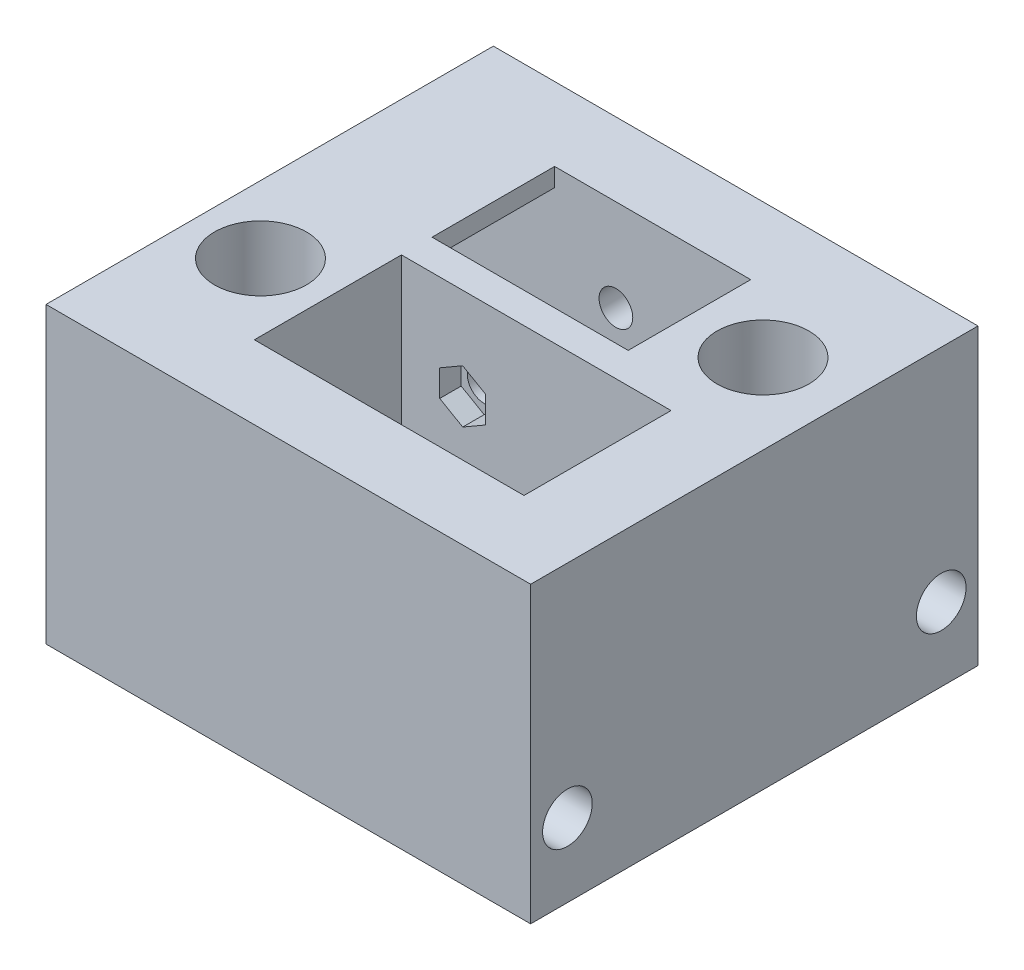
from build123d import *

# Parameters (mm, degrees)
SKETCH1_R           = 7.5
SKETCH1_W           = 44
SKETCH1_H           = 24
BOSS_EXTRUDE1_DEPTH = 48
SKETCH3_R           = 4.05
CUT_EXTRUDE1_DEPTH  = 82
SKETCH4_R           = 2.75
CUT_EXTRUDE2_DEPTH  = 82
SKETCH6_W           = 22
SKETCH6_H           = 20
BOSS_EXTRUDE3_DEPTH = 3
SKETCH7_W           = 22
SKETCH7_H           = 20
BOSS_EXTRUDE4_DEPTH = 21
CUT_EXTRUDE4_DEPTH  = 3.5


with BuildPart() as part:
    # Sketch1 → Boss-Extrude1 (new body)
    with BuildSketch(Plane(origin=(0, 0, 0), x_dir=(1, 0, 0), z_dir=(0, 1, 0))):
        Polygon((44, -12), (-22, -12), (-22, 29), (32, 29), (32, 49), (-22, 49), (-22, 61), (44, 61), (57.086114139, 61), (57.086114139, -12), align=None)
        with Locations((-11, 12)):
            Circle(SKETCH1_R, mode=Mode.SUBTRACT)
        with Locations((22, 12)):
            Rectangle(SKETCH1_W, SKETCH1_H, mode=Mode.SUBTRACT)
        with BuildLine():
            ThreePointArc((44, 46.5), (36.5, 39), (44, 31.5))
            ThreePointArc((44, 31.5), (51.5, 39), (44, 46.5))
        make_face(mode=Mode.SUBTRACT)
    extrude(amount=BOSS_EXTRUDE1_DEPTH)

    # Sketch3 → Cut-Extrude1 (cut)
    with BuildSketch(Plane.ZY.offset(22)):
        with Locations((-55, 12)):
            Circle(SKETCH3_R)
        with Locations((6, 12)):
            Circle(SKETCH3_R)
    extrude(amount=-CUT_EXTRUDE1_DEPTH, mode=Mode.SUBTRACT)

    # Sketch4 → Cut-Extrude2 (cut)
    with BuildSketch(Plane.XY.offset(-24)):
        with Locations((10, 33)):
            Circle(SKETCH4_R)
    extrude(amount=-CUT_EXTRUDE2_DEPTH, mode=Mode.SUBTRACT)

    # Sketch6 → Boss-Extrude3 (add)
    with BuildSketch(Plane(origin=(0, 48, 0), x_dir=(1, 0, 0), z_dir=(0, 1, 0))):
        with Locations((-11, 39)):
            Rectangle(SKETCH6_W, SKETCH6_H)
    extrude(amount=-BOSS_EXTRUDE3_DEPTH)

    # Sketch7 → Boss-Extrude4 (add)
    with BuildSketch(Plane(origin=(0, 0, 0), x_dir=(-1, 0, 0), z_dir=(0, -1, 0))):
        with Locations((11, 39)):
            Rectangle(SKETCH7_W, SKETCH7_H)
    extrude(amount=-BOSS_EXTRUDE4_DEPTH)

    # Sketch8 → Cut-Extrude4 (cut)
    with BuildSketch(Plane.XY.offset(-24)):
        Polygon((10, 37.330127019), (6.25, 35.165063509), (6.25, 30.834936491), (10, 28.669872981), (13.75, 30.834936491), (13.75, 35.165063509), align=None)
    extrude(amount=-CUT_EXTRUDE4_DEPTH, mode=Mode.SUBTRACT)


solid = part.part
